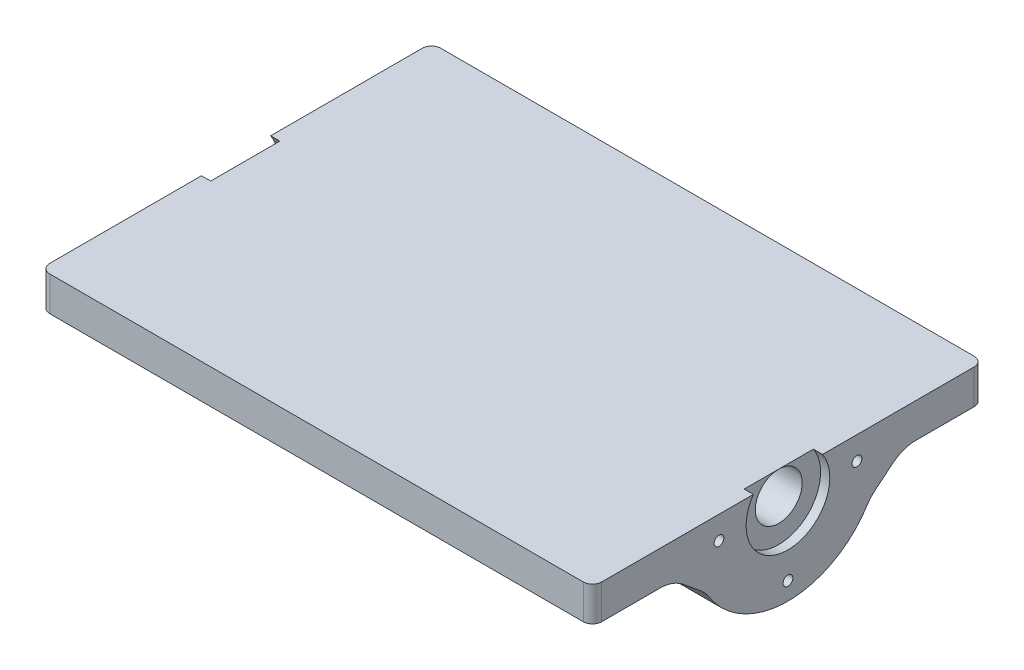
from build123d import *

# Parameters (mm, degrees)
SKETCH1_W           = 152.4
SKETCH1_H           = 38.1
BOSS_EXTRUDE1_DEPTH = 107.95
SKETCH2_R           = 1.35255
CUT_EXTRUDE1_DEPTH  = 152.4
SKETCH3_R           = 6.477
CUT_EXTRUDE4_DEPTH  = 154.686
SKETCH4_R           = 11.557
CUT_EXTRUDE5_DEPTH  = 2.54
CUT_EXTRUDE6_DEPTH  = 152.4
CHAMFER1_SIZE       = 6.35
FILLET1_R           = 10
FILLET2_R           = 2.54


with BuildPart() as part:
    # Sketch1 → Boss-Extrude1 (new body)
    with BuildSketch(Plane.XY):
        with Locations((-76.2, -19.05)):
            Rectangle(SKETCH1_W, SKETCH1_H)
    extrude(amount=BOSS_EXTRUDE1_DEPTH)

    # Sketch2 → Cut-Extrude1 (cut)
    with BuildSketch(Plane(origin=(0, 0, 0), x_dir=(0, 0, -1), z_dir=(1, 0, 0))):
        with Locations(Location((-73.025, -6.35, 0), (0, 0, 90))):
            Circle(SKETCH2_R)
        with BuildLine():
            ThreePointArc((-52.62245, -25.4), (-53.018602723, -24.443602723), (-53.975, -24.04745))
            Line((-53.975, -24.04745), (-53.975, -26.75255))
            ThreePointArc((-53.975, -26.75255), (-53.018602723, -26.356397277), (-52.62245, -25.4))
        make_face()
        with BuildLine():
            Line((-53.975, -26.75255), (-53.975, -24.04745))
            ThreePointArc((-53.975, -24.04745), (-55.32755, -25.4), (-53.975, -26.75255))
        make_face()
        with Locations(Location((-34.925, -6.35, 0), (0, 0, 90))):
            Circle(SKETCH2_R)
    extrude(amount=-CUT_EXTRUDE1_DEPTH, mode=Mode.SUBTRACT)

    # Sketch3 → Cut-Extrude4 (cut)
    with BuildSketch(Plane(origin=(0, 0, 0), x_dir=(0, 0, -1), z_dir=(1, 0, 0))):
        with Locations(Location((-53.975, -6.5024, 0), (0, 0, 90))):
            Circle(SKETCH3_R)
    extrude(amount=-CUT_EXTRUDE4_DEPTH, mode=Mode.SUBTRACT)

    # Sketch4 → Cut-Extrude5 (cut)
    with BuildSketch(Plane(origin=(0, 0, 0), x_dir=(0, 0, -1), z_dir=(1, 0, 0))):
        with Locations((-53.975, -6.5024)):
            Circle(SKETCH4_R)
    cut_extrude5 = extrude(amount=-CUT_EXTRUDE5_DEPTH, mode=Mode.SUBTRACT)

    # Mirror1: Cut-Extrude5 across plane
    add(cut_extrude5.mirror(Plane(origin=(-76.2, 0, 0), x_dir=(0, 0, 1), z_dir=(1, 0, 0))), mode=Mode.SUBTRACT)

    # Sketch5 → Cut-Extrude6 (cut)
    with BuildSketch(Plane(origin=(0, 0, 0), x_dir=(0, 0, -1), z_dir=(1, 0, 0))):
        with BuildLine():
            Line((-107.95, -9.525), (-79.375, -9.525))
            ThreePointArc((-79.375, -9.525), (-53.975, -30.327663184), (-28.575, -9.525))
            Line((-28.575, -9.525), (0, -9.525))
            Line((0, -9.525), (0, -59.754484856))
            Line((0, -59.754484856), (-107.95, -59.754484856))
            Line((-107.95, -59.754484856), (-107.95, -9.525))
        make_face()
    extrude(amount=-CUT_EXTRUDE6_DEPTH, mode=Mode.SUBTRACT)

    # Chamfer1
    # the kernel refuses this chamfer: 6.35 mm, written as the material it adds along each edge
    with BuildSketch(Plane(origin=(0, -9.525, 79.375), x_dir=(0, -0.9387392646709182, -0.34462819525555927), z_dir=(-1, 0, 0))) as chamfer1_piece_1:
        with BuildLine():
            Line((7.921952063, 0), (-CHAMFER1_SIZE * 0.344628195256, CHAMFER1_SIZE * 0.938739264671))
            Line((-CHAMFER1_SIZE * 0.344628195256, CHAMFER1_SIZE * 0.938739264671), (0, 0))
            ThreePointArc((0, 0), (4.071956682, 0.304341963), (7.921952063, 0))
        make_face()
    extrude(amount=152.4)
    with BuildSketch(Plane(origin=(0, -9.525, 28.575), x_dir=(0, 0, -1), z_dir=(-1, 0, 0))) as chamfer1_piece_2:
        with BuildLine():
            Line((CHAMFER1_SIZE, 0), (-2.730128042, 7.436647454))
            ThreePointArc((-2.730128042, 7.436647454), (-1.117613332, 3.927390442), (0, 0))
            Line((0, 0), (CHAMFER1_SIZE, 0))
        make_face()
    extrude(amount=152.4)

    # Fillet1
    fillet1_edges = [part.edges().sort_by_distance(p)[0] for p in [
        (-76.2, -9.525, 85.725),
        (-76.2, -16.961647454, 31.305128042),
        (-76.2, -16.961647454, 76.644871958),
        (-76.2, -9.525, 22.225),
    ]]
    fillet(fillet1_edges, radius=FILLET1_R)

    # Fillet2
    fillet2_edges = [part.edges().sort_by_distance(p)[0] for p in [
        (-152.4, -4.7625, 107.95),
        (-152.4, -4.7625, 0),
        (0, -4.7625, 0),
        (0, -4.7625, 107.95),
    ]]
    fillet(fillet2_edges, radius=FILLET2_R)


solid = part.part
